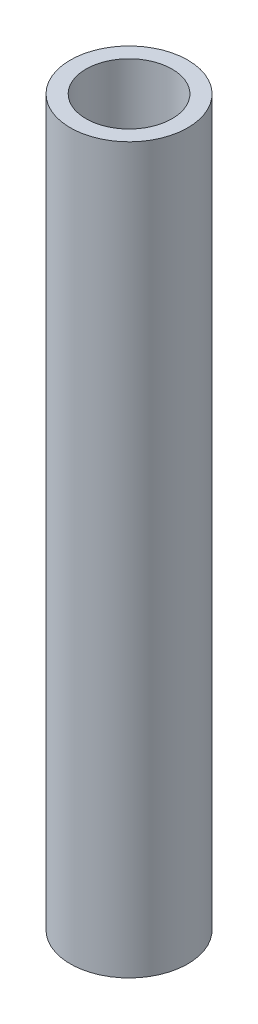
from build123d import *

# Parameters (mm, degrees)
THREAD1_PITCH = 1.058333333


with BuildPart() as part:
    # Sketch2 → Revolve1 (revolve)
    with BuildSketch(Plane.XY, mode=Mode.PRIVATE) as revolve1_sk:
        Polygon((-3.96875, 0), (-3.96875, 12.7), (-6.985, 12.7), (-6.985, 117.475), (-9.525, 117.475), (-9.525, 0), align=None)
    revolve(revolve1_sk.sketch.rotate(Axis((0, 0, 0), (0, 1, 0)), 270), axis=Axis((0, 0, 0), (0, 1, 0)))

    # Thread1: the profile of Thread Profile1 profile screwed along a right-hand helix of 24 turns, 8 arcs to a turn; built about Z, then put on its axis
    thread1_z = Axis((0, 0, 0), (0, 0, 1))
    thread1_corners = [(3.96845, 0, -0.000173205), (4.541589718, 0, 0.330729165), (4.541589718, 0, 0.463020832), (3.96845, 0, 0.793923202)]
    with BuildLine(mode=Mode.PRIVATE) as thread1_profile:
        Line(thread1_corners[0], thread1_corners[1])
        Line(thread1_corners[1], thread1_corners[2])
        Line(thread1_corners[2], thread1_corners[3])
        Line(thread1_corners[3], thread1_corners[0])
    thread1_cap = Face(thread1_profile.wire())
    thread1_turn_angles = [0, 22.5, 45, 67.5, 90, 112.5, 135, 157.5, 180, 202.5, 225, 247.5, 270, 292.5, 315, 337.5, 360]
    thread1_turn_weights = [1, 0.9238795325112867, 1, 0.9238795325112867, 1, 0.9238795325112867, 1, 0.9238795325112867, 1, 0.9238795325112867, 1, 0.9238795325112867, 1, 0.9238795325112867, 1, 0.9238795325112867, 1]
    thread1_turn_rails = [Edge.make_bspline([Vector(p[0], p[1], 0).rotate(thread1_z, thread1_turn_angles[k]) / thread1_turn_weights[k] + Vector(0, 0, p[2] + THREAD1_PITCH * thread1_turn_angles[k] / 360) for k in range(17)], [0, 0, 0, 1, 1, 2, 2, 3, 3, 4, 4, 5, 5, 6, 6, 7, 7, 8, 8, 8], 2, thread1_turn_weights) for p in thread1_corners]
    thread1_turn_sides = [Face.make_surface_from_curves(thread1_turn_rails[p[0]], thread1_turn_rails[p[1]]) for p in [(0, 1), (1, 2), (2, 3), (3, 0)]]
    thread1 = Plane(origin=(0, 0, 0), x_dir=(1, 0, 0), z_dir=(0, 1, 0)) * Solid(Shell([*[p.moved(Location((0, 0, THREAD1_PITCH * i))) for i in range(24) for p in thread1_turn_sides], thread1_cap, thread1_cap.rotate(thread1_z, 8640).moved(Location((0, 0, THREAD1_PITCH * 8640 / 360)))]))
    add(thread1, mode=Mode.SUBTRACT)


solid = part.part
